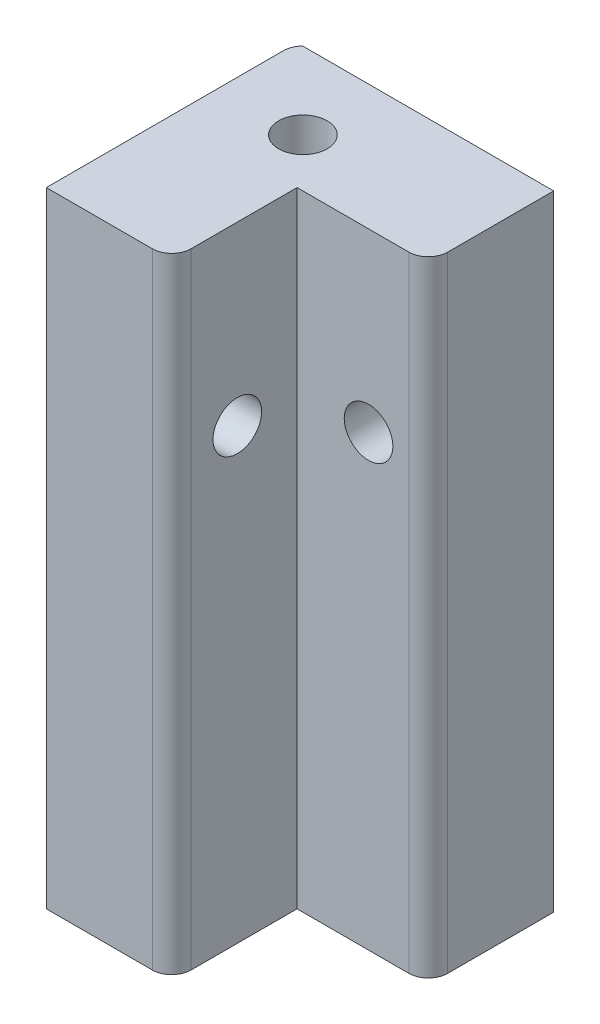
from build123d import *

# Parameters (mm, degrees)
HOLE_TOPMAIN_OUTLINE_W = 12.9
HOLE_TOPMAIN_OUTLINE_H = 12.9
HOLE_TOPMAIN_OUTLINE_R = 2.5
HOLE_TOPMAIN_DEPTH     = 64.27
SKETCH14_R             = 2.5
CUT_EXTRUDE9_DEPTH     = 67.100627077
SKETCH15_R             = 3.25
CUT_EXTRUDE10_DEPTH    = 66.309210028
SKETCH18_W             = 12.9
SKETCH18_H             = 64.27
SKETCH18_R             = 3.25
BOSS_EXTRUDE2_DEPTH    = 13.5
FILLET3_R              = 2
SKETCH19_R             = 2.5
CUT_EXTRUDE11_DEPTH    = 13.5
SKETCH22_W             = 13.5
SKETCH22_H             = 64.27
BOSS_EXTRUDE3_DEPTH    = 13.5
BOSS_EXTRUDE5_START    = -26.4
SKETCH24_R             = 3.25
BOSS_EXTRUDE5_DEPTH    = 26.4
CUT_EXTRUDE12_START    = -64.27
SKETCH25_R             = 2.5
CUT_EXTRUDE12_DEPTH    = 64.27
SKETCH26_R             = 2.5
CUT_EXTRUDE13_DEPTH    = 13.5
SKETCH28_R             = 2.5
CUT_EXTRUDE14_DEPTH    = 13.5
FILLET4_R              = 2
SKETCH31_W             = 26.4
SKETCH31_H             = 0.6
CUT_EXTRUDE15_DEPTH    = 64.27


# Read off the part's stored shape, not the designer's step: hole-TopMain
with BuildPart() as part:
    # hole-TopMain outline → hole-TopMain (new body)
    with BuildSketch(Plane(origin=(0, 0, 0), x_dir=(1, 0, 0), z_dir=(0, 1, 0))):
        with Locations((-2.05, 2.05)):
            Rectangle(HOLE_TOPMAIN_OUTLINE_W, HOLE_TOPMAIN_OUTLINE_H)
        Circle(HOLE_TOPMAIN_OUTLINE_R, mode=Mode.SUBTRACT)
    extrude(amount=HOLE_TOPMAIN_DEPTH)

    # Sketch14 → Cut-Extrude9 (cut, through all)
    with BuildSketch(Plane(origin=(0, 0, -8.5), x_dir=(-1, 0, 0), z_dir=(0, 0, -1))):
        with Locations((1.75, 46.135)):
            Circle(SKETCH14_R)
    extrude(amount=-CUT_EXTRUDE9_DEPTH, mode=Mode.SUBTRACT)

    # Sketch15 → Cut-Extrude10 (cut, through all)
    with BuildSketch(Plane(origin=(0, 0, -3.5), x_dir=(-1, 0, 0), z_dir=(0, 0, -1))):
        with Locations((1.75, 46.135)):
            Circle(SKETCH15_R)
    extrude(amount=-CUT_EXTRUDE10_DEPTH, mode=Mode.SUBTRACT)

    # Sketch18 → Boss-Extrude2 (add)
    with BuildSketch(Plane.XY.offset(4.4)):
        with Locations((-2.05, 32.135)):
            Rectangle(SKETCH18_W, SKETCH18_H)
        with Locations(Location((-1.75, 46.135, 0), (0, 0, 180))):
            Circle(SKETCH18_R, mode=Mode.SUBTRACT)
    extrude(amount=BOSS_EXTRUDE2_DEPTH)

    # Fillet3
    fillet3_edges = [part.edges().sort_by_distance(p)[0] for p in [
        (-8.5, 32.135, -8.5),
        (4.4, 32.135, 17.9),
    ]]
    fillet(fillet3_edges, radius=FILLET3_R)

    # Sketch19 → Cut-Extrude11 (cut)
    with BuildSketch(Plane.ZY.offset(8.5)):
        with Locations((11.15, 46.135)):
            Circle(SKETCH19_R)
    extrude(amount=-CUT_EXTRUDE11_DEPTH, mode=Mode.SUBTRACT)

    # Sketch22 → Boss-Extrude3 (add)
    with BuildSketch(Plane(origin=(4.4, 0, 0), x_dir=(0, 0, -1), z_dir=(1, 0, 0))):
        with Locations((1.75, 32.135)):
            Rectangle(SKETCH22_W, SKETCH22_H)
    extrude(amount=BOSS_EXTRUDE3_DEPTH)

    # Sketch24 → Boss-Extrude5 (add)
    with BuildSketch(Plane.XY.offset(17.9).offset(BOSS_EXTRUDE5_START)):
        with Locations((-1.75, 46.135)):
            Circle(SKETCH24_R)
    extrude(amount=BOSS_EXTRUDE5_DEPTH)

    # Sketch25 → Cut-Extrude12 (cut)
    with BuildSketch(Plane(origin=(0, 64.27, 0), x_dir=(1, 0, 0), z_dir=(0, 1, 0)).offset(CUT_EXTRUDE12_START)):
        with Locations(Location((0, 0, 0), (0, 0, 90))):
            Circle(SKETCH25_R)
    extrude(amount=CUT_EXTRUDE12_DEPTH, mode=Mode.SUBTRACT)

    # Sketch26 → Cut-Extrude13 (cut)
    with BuildSketch(Plane.ZY.offset(8.5)):
        with Locations((11.15, 46.135)):
            Circle(SKETCH26_R)
    extrude(amount=-CUT_EXTRUDE13_DEPTH, mode=Mode.SUBTRACT)

    # Sketch28 → Cut-Extrude14 (cut)
    with BuildSketch(Plane(origin=(0, 0, -8.5), x_dir=(-1, 0, 0), z_dir=(0, 0, -1))):
        with Locations((-11.75, 46.135)):
            Circle(SKETCH28_R)
    extrude(amount=-CUT_EXTRUDE14_DEPTH, mode=Mode.SUBTRACT)

    # Fillet4
    fillet4_edges = [part.edges().sort_by_distance(p)[0] for p in [
        (17.9, 32.135, 5),
    ]]
    fillet(fillet4_edges, radius=FILLET4_R)

    # Sketch31 → Cut-Extrude15 (cut)
    with BuildSketch(Plane(origin=(0, 64.27, 0), x_dir=(1, 0, 0), z_dir=(0, 1, 0))):
        with Locations((4.7, 8.2)):
            Rectangle(SKETCH31_W, SKETCH31_H)
    extrude(amount=-CUT_EXTRUDE15_DEPTH, mode=Mode.SUBTRACT)


solid = part.part
